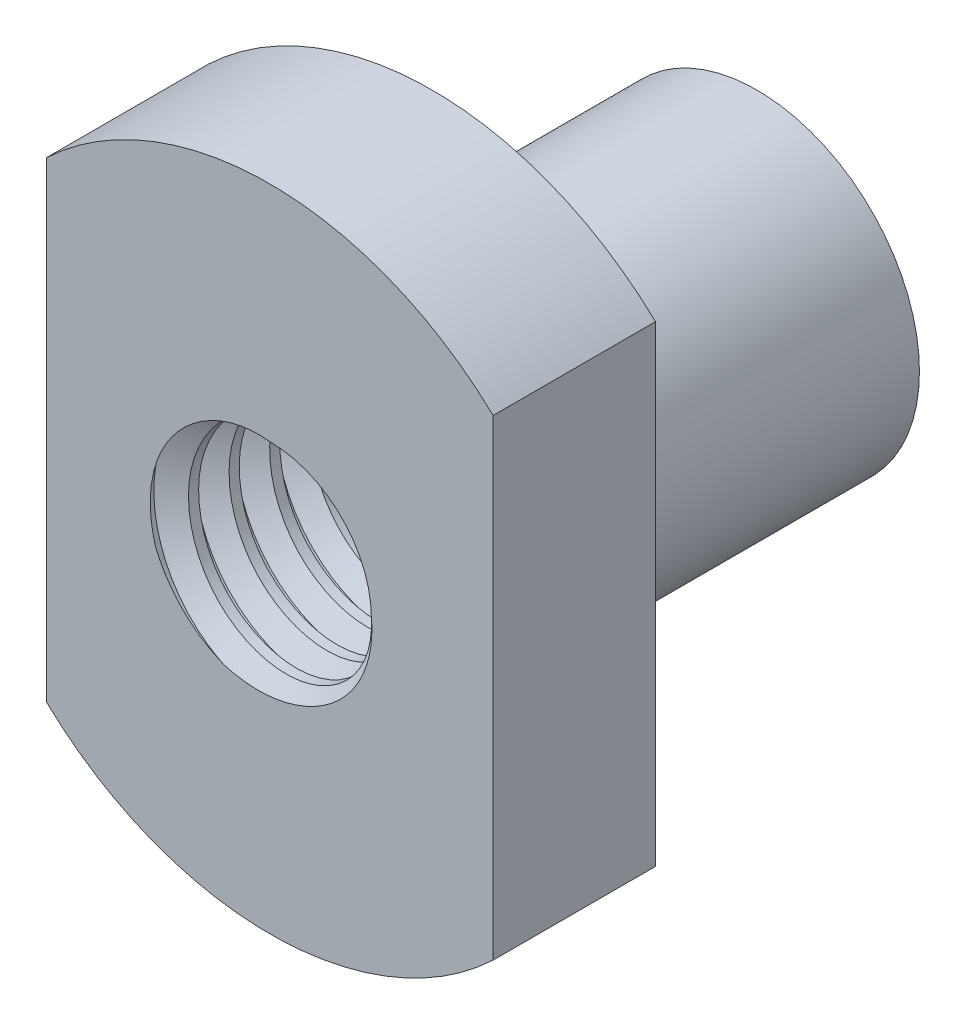
from build123d import *

# Parameters (mm, degrees)
SCHIZZO1_R                          = 2
ESTRUSIONE_ESTRUSIONE1_DEPTH        = 4
SCHIZZO2_R                          = 4
ESTRUSIONE_ESTRUSIONE2_DEPTH        = 2
TAGLIO_ESTRUSIONE1_START            = -2
TAGLIO_ESTRUSIONE1_DEPTH            = 2
PREFORO_DA_MASCHIARE_M3X0_5_1_D     = 2.5
PREFORO_DA_MASCHIARE_M3X0_5_1_DEPTH = 39.248924226
PREFORO_DA_MASCHIARE_M3X0_5_1_TIP   = 0.751075774
FILETTATURA1_PITCH                  = 0.5


with BuildPart() as part:
    # Schizzo1 → Estrusione-Estrusione1 (new body)
    with BuildSketch(Plane.XY):
        Circle(SCHIZZO1_R)
    extrude(amount=ESTRUSIONE_ESTRUSIONE1_DEPTH)

    # Schizzo2 → Estrusione-Estrusione2 (add)
    with BuildSketch(Plane.XY.offset(4)):
        Circle(SCHIZZO2_R)
    extrude(amount=ESTRUSIONE_ESTRUSIONE2_DEPTH)

    # Schizzo3 → Taglio-Estrusione1 (cut)
    with BuildSketch(Plane.XY.offset(6).offset(TAGLIO_ESTRUSIONE1_START)):
        with BuildLine():
            Line((-2.75, 2.90473751), (-2.75, -2.90473751))
            ThreePointArc((-2.75, -2.90473751), (-4, 0), (-2.75, 2.90473751))
        make_face()
        with BuildLine():
            Line((2.75, 2.90473751), (2.75, -2.90473751))
            ThreePointArc((2.75, -2.90473751), (4, 0), (2.75, 2.90473751))
        make_face()
    extrude(amount=TAGLIO_ESTRUSIONE1_DEPTH, mode=Mode.SUBTRACT)

    # Preforo da maschiare M3x0.5-1
    with Locations(Plane(origin=(0, 0, 0), x_dir=(-1, 0, 0), z_dir=(0, 0, -1))):
        with Locations((0, 0)):
            Hole(PREFORO_DA_MASCHIARE_M3X0_5_1_D / 2, depth=PREFORO_DA_MASCHIARE_M3X0_5_1_DEPTH)
            with Locations((0, 0, -(PREFORO_DA_MASCHIARE_M3X0_5_1_DEPTH + PREFORO_DA_MASCHIARE_M3X0_5_1_TIP / 2))):  # 118° drill point
                Cone(0, PREFORO_DA_MASCHIARE_M3X0_5_1_D / 2, PREFORO_DA_MASCHIARE_M3X0_5_1_TIP, mode=Mode.SUBTRACT)

    # Filettatura1: the profile of Profilo filettatura1 profile screwed along a right-hand helix of 20 turns, 6 arcs to a turn; built about Z, then put on its axis
    filettatura1_z = Axis((0, 0, 0), (0, 0, 1))
    filettatura1_corners = [(1.2497, 0, -0.000173205), (1.520632937, 0, 0.156249999), (1.520632937, 0, 0.218749999), (1.2497, 0, 0.375173204)]
    with BuildLine(mode=Mode.PRIVATE) as filettatura1_profile:
        Line(filettatura1_corners[0], filettatura1_corners[1])
        Line(filettatura1_corners[1], filettatura1_corners[2])
        Line(filettatura1_corners[2], filettatura1_corners[3])
        Line(filettatura1_corners[3], filettatura1_corners[0])
    filettatura1_cap = Face(filettatura1_profile.wire())
    filettatura1_turn_angles = [0, 30, 60, 90, 120, 150, 180, 210, 240, 270, 300, 330, 360]
    filettatura1_turn_weights = [1, 0.8660254037844387, 1, 0.8660254037844387, 1, 0.8660254037844387, 1, 0.8660254037844387, 1, 0.8660254037844387, 1, 0.8660254037844387, 1]
    filettatura1_turn_rails = [Edge.make_bspline([Vector(p[0], p[1], 0).rotate(filettatura1_z, filettatura1_turn_angles[k]) / filettatura1_turn_weights[k] + Vector(0, 0, p[2] + FILETTATURA1_PITCH * filettatura1_turn_angles[k] / 360) for k in range(13)], [0, 0, 0, 1, 1, 2, 2, 3, 3, 4, 4, 5, 5, 6, 6, 6], 2, filettatura1_turn_weights) for p in filettatura1_corners]
    filettatura1_turn_sides = [Face.make_surface_from_curves(filettatura1_turn_rails[p[0]], filettatura1_turn_rails[p[1]]) for p in [(0, 1), (1, 2), (2, 3), (3, 0)]]
    filettatura1 = Plane(origin=(0, 0, 0), x_dir=(1, 0, 0), z_dir=(0, 0, 1)) * Solid(Shell([*[p.moved(Location((0, 0, FILETTATURA1_PITCH * i))) for i in range(20) for p in filettatura1_turn_sides], filettatura1_cap, filettatura1_cap.rotate(filettatura1_z, 7200).moved(Location((0, 0, FILETTATURA1_PITCH * 7200 / 360)))]))
    add(filettatura1, mode=Mode.SUBTRACT)


solid = part.part
